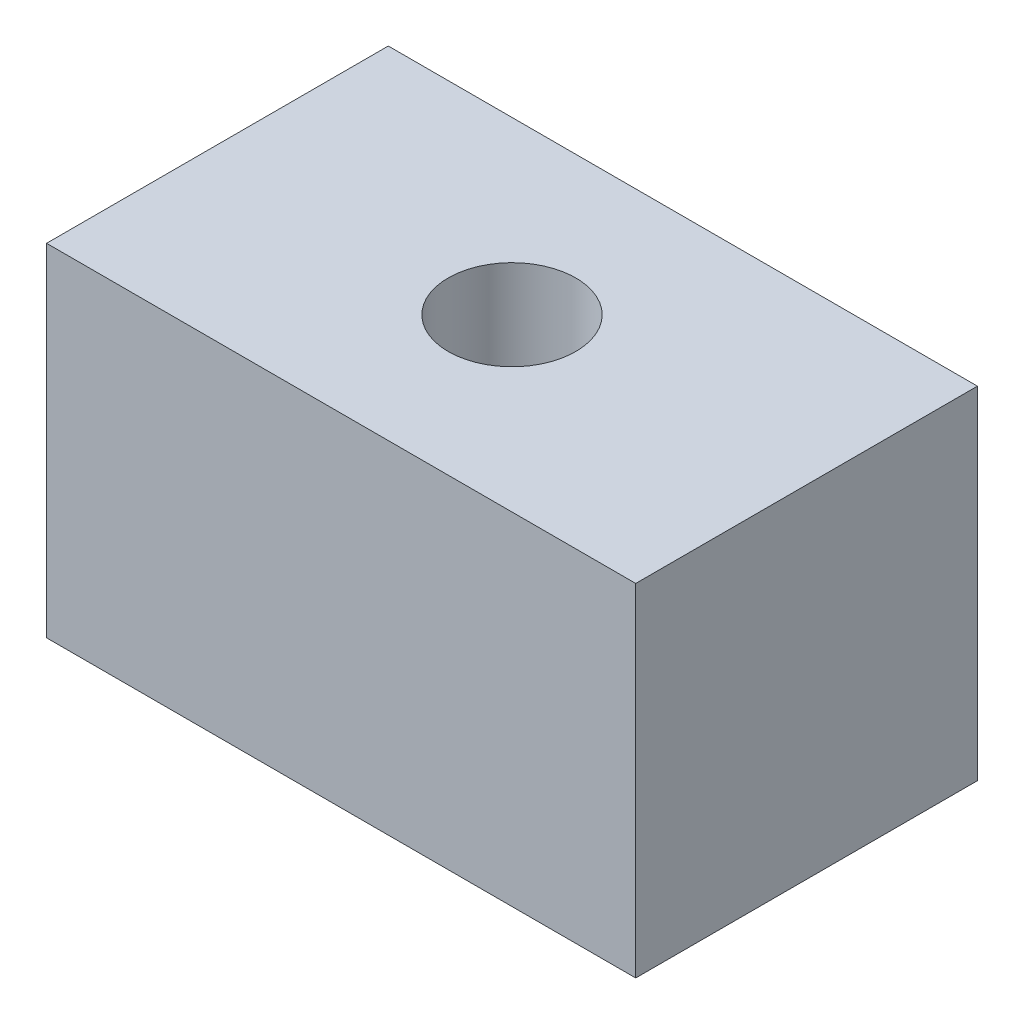
from build123d import *

# Parameters (mm, degrees)
SKETCH1_W           = 14.732
SKETCH1_H           = 14.732
BOSS_EXTRUDE1_DEPTH = 25.4
SKETCH2_R           = 2.75
CUT_EXTRUDE1_DEPTH  = 31.272921564
SKETCH3_W           = 10
SKETCH3_H           = 6.858
SKETCH3_R           = 1.5875
CUT_EXTRUDE2_DEPTH  = 1.778
FILLET1_R           = 0.79375


with BuildPart() as part:
    # Sketch1 → Boss-Extrude1 (new body)
    with BuildSketch(Plane(origin=(0, 0, 0), x_dir=(0, 0, -1), z_dir=(1, 0, 0))):
        Rectangle(SKETCH1_W, SKETCH1_H)
    extrude(amount=BOSS_EXTRUDE1_DEPTH)

    # Sketch2 → Cut-Extrude1 (cut, through all)
    with BuildSketch(Plane(origin=(0, 7.366, 0), x_dir=(1, 0, 0), z_dir=(0, 1, 0))):
        with Locations((12.7, 0)):
            Circle(SKETCH2_R)
    extrude(amount=-CUT_EXTRUDE1_DEPTH, mode=Mode.SUBTRACT)

    # Sketch3 → Cut-Extrude2 (cut)
    with BuildSketch(Plane(origin=(0, 0, -7.366), x_dir=(-1, 0, 0), z_dir=(0, 0, -1))):
        with Locations((-5, -0.063)):
            Rectangle(SKETCH3_W, SKETCH3_H)
        with Locations((-4.92, -0.063)):
            Circle(SKETCH3_R, mode=Mode.SUBTRACT)
    extrude(amount=-CUT_EXTRUDE2_DEPTH, mode=Mode.SUBTRACT)

    # Fillet1
    fillet1_edges = [part.edges().sort_by_distance(p)[0] for p in [
        (10, 3.366, -6.477),
        (10, -3.492, -6.477),
    ]]
    fillet(fillet1_edges, radius=FILLET1_R)


solid = part.part
